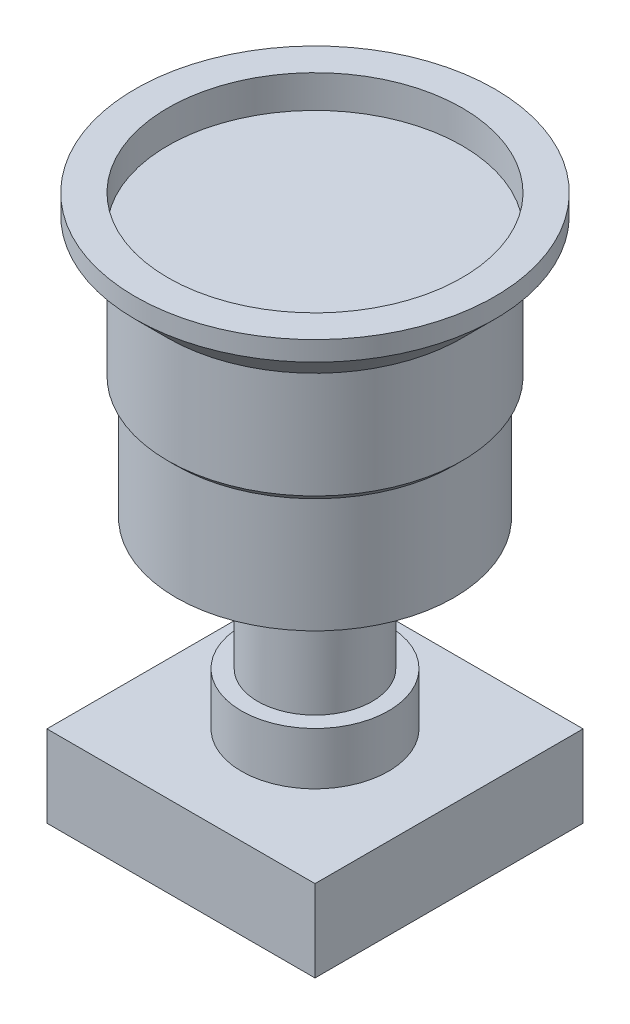
from build123d import *

# Parameters (mm, degrees)
SKETCH1_W           = 164
SKETCH1_H           = 164
BOSS_EXTRUDE1_DEPTH = 50
SKETCH2_R           = 45
BOSS_EXTRUDE2_DEPTH = 32
SKETCH3_R           = 35
BOSS_EXTRUDE3_DEPTH = 45
SKETCH4_R           = 42.5
BOSS_EXTRUDE4_DEPTH = 25
SKETCH5_R           = 85
BOSS_EXTRUDE5_DEPTH = 80
SKETCH6_R           = 90
BOSS_EXTRUDE6_DEPTH = 70
SKETCH7_R           = 110
BOSS_EXTRUDE7_DEPTH = 32
CHAMFER1_SIZE       = 20
CHAMFER2_SIZE       = 5
CHAMFER3_SIZE       = 10
CHAMFER3_SIZE_2     = 56.712818196
CHAMFER4_SIZE       = 5
CHAMFER4_SIZE_2     = 8.660254038
CUT_EXTRUDE1_START  = -20
SKETCH8_R           = 90
CUT_EXTRUDE1_DEPTH  = 20


# Some blends are built 0.0001 mm under size
with BuildPart() as part:
    # Sketch1 → Boss-Extrude1 (new body)
    with BuildSketch(Plane(origin=(0, 0, 0), x_dir=(1, 0, 0), z_dir=(0, 1, 0))):
        with Locations((82, 82)):
            Rectangle(SKETCH1_W, SKETCH1_H)
    extrude(amount=BOSS_EXTRUDE1_DEPTH)

    # Sketch2 → Boss-Extrude2 (add)
    with BuildSketch(Plane(origin=(0, 50, 0), x_dir=(1, 0, 0), z_dir=(0, 1, 0))):
        with Locations(Location((82, 82, 0), (0, 0, 270))):
            Circle(SKETCH2_R)
    extrude(amount=BOSS_EXTRUDE2_DEPTH)

    # Sketch3 → Boss-Extrude3 (add)
    with BuildSketch(Plane(origin=(0, 82, 0), x_dir=(1, 0, 0), z_dir=(0, 1, 0))):
        with Locations(Location((82, 82, 0), (0, 0, 90))):
            Circle(SKETCH3_R)
    extrude(amount=BOSS_EXTRUDE3_DEPTH)

    # Sketch4 → Boss-Extrude4 (add)
    with BuildSketch(Plane(origin=(0, 127, 0), x_dir=(1, 0, 0), z_dir=(0, 1, 0))):
        with Locations(Location((82, 82, 0), (0, 0, 270))):
            Circle(SKETCH4_R)
    extrude(amount=BOSS_EXTRUDE4_DEPTH)

    # Sketch5 → Boss-Extrude5 (add)
    with BuildSketch(Plane(origin=(0, 152, 0), x_dir=(1, 0, 0), z_dir=(0, 1, 0))):
        with Locations(Location((82, 82, 0), (0, 0, 270))):
            Circle(SKETCH5_R)
    extrude(amount=BOSS_EXTRUDE5_DEPTH)

    # Sketch6 → Boss-Extrude6 (add)
    with BuildSketch(Plane(origin=(0, 232, 0), x_dir=(1, 0, 0), z_dir=(0, 1, 0))):
        with Locations(Location((82, 82, 0), (0, 0, 270))):
            Circle(SKETCH6_R)
    extrude(amount=BOSS_EXTRUDE6_DEPTH)

    # Sketch7 → Boss-Extrude7 (add)
    with BuildSketch(Plane(origin=(0, 302, 0), x_dir=(1, 0, 0), z_dir=(0, 1, 0))):
        with Locations(Location((82, 82, 0), (0, 0, 270))):
            Circle(SKETCH7_R)
    extrude(amount=BOSS_EXTRUDE7_DEPTH)

    # Chamfer1
    chamfer1_edges = [part.edges().sort_by_distance(p)[0] for p in [
        (82, 302, -192),
    ]]
    chamfer(chamfer1_edges, length=CHAMFER1_SIZE - 0.0001)  # a hair under: the kernel refuses the full size

    # Chamfer2
    chamfer2_edges = [part.edges().sort_by_distance(p)[0] for p in [
        (82, 232, -172),
    ]]
    chamfer(chamfer2_edges, length=CHAMFER2_SIZE - 0.0001)  # a hair under: the kernel refuses the full size

    # Chamfer3
    # the kernel refuses this chamfer: 56.712818196, 10 mm, written as the material it takes off along each edge
    with BuildSketch(Plane(origin=(82, 152, -82), x_dir=(0, 0, 1), z_dir=(-1, 0, 0))) as chamfer3_piece_1_section:
        Polygon((85, CHAMFER3_SIZE), (85 - CHAMFER3_SIZE_2, 0), (85, 0), align=None)
    chamfer3_piece_1 = revolve(axis=Axis((82, 152, -82), (0, 1, 0)), mode=Mode.PRIVATE)
    chamfer3_piece_1 = chamfer3_piece_1 - Plane(origin=(82, 157.937254532, -82), x_dir=(0, 0, 1), z_dir=(0, -1, 0)) * Cylinder(42.5, 340, mode=Mode.PRIVATE)
    add(chamfer3_piece_1, mode=Mode.SUBTRACT)

    # Chamfer4
    # the kernel refuses this chamfer: 8.660254038, 5 mm, written as the material it takes off along each edge
    with BuildSketch(Plane(origin=(82, 127, -82), x_dir=(0, 0, 1), z_dir=(-1, 0, 0))) as chamfer4_piece_1_section:
        Polygon((42.5, CHAMFER4_SIZE), (42.5 - CHAMFER4_SIZE_2, 0), (42.5, 0), align=None)
    chamfer4_piece_1 = revolve(axis=Axis((82, 127, -82), (0, 1, 0)), mode=Mode.PRIVATE)
    chamfer4_piece_1 = chamfer4_piece_1 - Plane(origin=(82, 129.764704239, -82), x_dir=(0, 0, -1), z_dir=(0, -1, 0)) * Cylinder(35, 170, mode=Mode.PRIVATE)
    add(chamfer4_piece_1, mode=Mode.SUBTRACT)

    # Sketch8 → Cut-Extrude1 (cut)
    with BuildSketch(Plane(origin=(0, 334, 0), x_dir=(1, 0, 0), z_dir=(0, 1, 0)).offset(CUT_EXTRUDE1_START)):
        with Locations(Location((82, 82, 0), (0, 0, 270))):
            Circle(SKETCH8_R)
    extrude(amount=CUT_EXTRUDE1_DEPTH, mode=Mode.SUBTRACT)


solid = part.part
